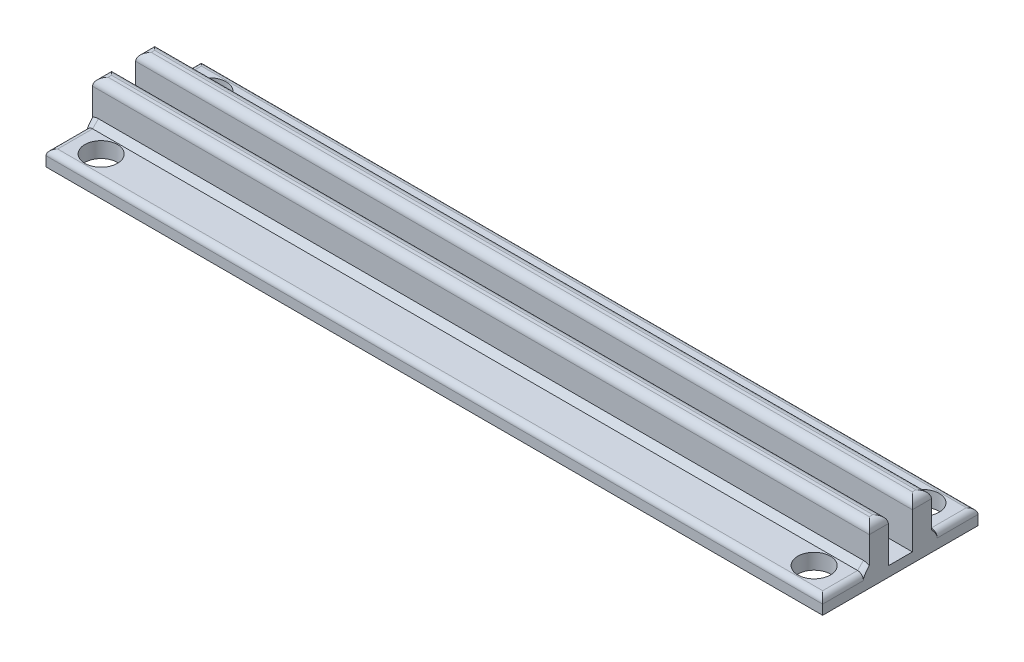
from build123d import *

# Parameters (mm, degrees)
SKETCH1_W           = 100
SKETCH1_H           = 8
BOSS_EXTRUDE1_DEPTH = 7
SKETCH3_W           = 100
SKETCH3_H           = 20
BOSS_EXTRUDE2_DEPTH = 2
SKETCH2_W           = 100
SKETCH2_H           = 3.1
CUT_EXTRUDE1_DEPTH  = 5.7
FILLET1_R           = 1
SKETCH4_R           = 2.1
CUT_EXTRUDE2_DEPTH  = 2
FILLET2_R           = 0.75
CHAMFER1_SIZE       = 0.75


with BuildPart() as part:
    # Sketch1 → Boss-Extrude1 (new body)
    with BuildSketch(Plane(origin=(0, 0, 0), x_dir=(1, 0, 0), z_dir=(0, 1, 0))):
        Rectangle(SKETCH1_W, SKETCH1_H)
    extrude(amount=BOSS_EXTRUDE1_DEPTH)

    # Sketch3 → Boss-Extrude2 (add)
    with BuildSketch(Plane(origin=(0, 0, 0), x_dir=(1, 0, 0), z_dir=(0, 1, 0))):
        Rectangle(SKETCH3_W, SKETCH3_H)
    extrude(amount=BOSS_EXTRUDE2_DEPTH)

    # Sketch2 → Cut-Extrude1 (cut)
    with BuildSketch(Plane(origin=(0, 7, 0), x_dir=(1, 0, 0), z_dir=(0, 1, 0))):
        Rectangle(SKETCH2_W, SKETCH2_H)
    extrude(amount=-CUT_EXTRUDE1_DEPTH, mode=Mode.SUBTRACT)

    # Fillet1
    fillet1_edges = [part.edges().sort_by_distance(p)[0] for p in [
        (-50, 7, -2.775),
        (0, 7, 4),
        (50, 7, -2.775),
        (-50, 7, 2.775),
        (0, 7, -1.55),
        (0, 7, 1.55),
        (50, 7, 2.775),
        (0, 7, -4),
    ]]
    fillet(fillet1_edges, radius=FILLET1_R)

    # Sketch4 → Cut-Extrude2 (cut)
    with BuildSketch(Plane(origin=(0, 2, 0), x_dir=(1, 0, 0), z_dir=(0, 1, 0))):
        with Locations(Location((-45.9, 7, 0), (0, 0, 270))):
            Circle(SKETCH4_R)
        with Locations(Location((-45.9, -7, 0), (0, 0, 270))):
            Circle(SKETCH4_R)
        with Locations(Location((45.9, 7, 0), (0, 0, 270))):
            Circle(SKETCH4_R)
        with Locations(Location((45.9, -7, 0), (0, 0, 270))):
            Circle(SKETCH4_R)
    extrude(amount=-CUT_EXTRUDE2_DEPTH, mode=Mode.SUBTRACT)

    # Fillet2
    fillet2_edges = [part.edges().sort_by_distance(p)[0] for p in [
        (-50, 2, -7),
        (50, 2, -7),
        (0, 2, -10),
        (50, 2, 7),
        (-50, 2, 7),
        (0, 2, 10),
    ]]
    fillet(fillet2_edges, radius=FILLET2_R)

    # Chamfer1
    # the kernel refuses this chamfer: 0.75 mm, written as the material it adds along each edge
    with BuildSketch(Plane(origin=(49.25, 2, -4), x_dir=(0, -0.02749587661058648, -0.9996219169112968), z_dir=(-1, 0, 0)), Plane(origin=(-49.25, 2, 4), x_dir=(0, -0.02749587661058648, 0.9996219169112968), z_dir=(1, 0, 0))) as chamfer1_piece_1:
        Polygon((CHAMFER1_SIZE * 0.999621916911, -CHAMFER1_SIZE * 0.0274958766106), (-CHAMFER1_SIZE * 0.0274958766106, -CHAMFER1_SIZE * 0.999621916911), (0, 0), align=None)
    extrude(amount=98.5)
    with BuildSketch(Plane(origin=(49.25, 1.25, -4), x_dir=(-0.8425066666450713, -0.5386859165215022, 0), z_dir=(-0.5386859165215022, 0.8425066666450713, 0))) as chamfer1_piece_2_section:
        Polygon((0.75, -CHAMFER1_SIZE), (0.75 + CHAMFER1_SIZE, 0), (0.75, 0), align=None)
    chamfer1_piece_2 = revolve(axis=Axis((49.25, 1.25, -4), (0, 0, 1)), revolution_arc=237.405771779, mode=Mode.PRIVATE)
    chamfer1_piece_2 = split(chamfer1_piece_2, bisect_by=Plane(origin=(50, 1.825736319, -4.33178547), z_dir=(-1, 0, 0)), keep=Keep.TOP, mode=Mode.PRIVATE)
    chamfer1_piece_2 = split(chamfer1_piece_2, bisect_by=Plane(origin=(49.825736319, 0, -4.33178547), z_dir=(0, 1, 0)), keep=Keep.TOP, mode=Mode.PRIVATE)
    add(chamfer1_piece_2)
    with BuildSketch(Plane(origin=(49.25, 1.25, 4), x_dir=(-0.8425066666450713, -0.5386859165215022, 0), z_dir=(-0.5386859165215022, 0.8425066666450713, 0))) as chamfer1_piece_3_section:
        Polygon((0.75 + CHAMFER1_SIZE, 0), (0.75, CHAMFER1_SIZE), (0.75, 0), align=None)
    chamfer1_piece_3 = revolve(axis=Axis((49.25, 1.25, 4), (0, 0, 1)), revolution_arc=237.405771779, mode=Mode.PRIVATE)
    chamfer1_piece_3 = split(chamfer1_piece_3, bisect_by=Plane(origin=(50, 1.825736319, 4.33178547), z_dir=(-1, 0, 0)), keep=Keep.TOP, mode=Mode.PRIVATE)
    chamfer1_piece_3 = split(chamfer1_piece_3, bisect_by=Plane(origin=(49.825736319, 0, 4.33178547), z_dir=(0, 1, 0)), keep=Keep.TOP, mode=Mode.PRIVATE)
    add(chamfer1_piece_3)
    with BuildSketch(Plane(origin=(-49.25, 1.25, 4), x_dir=(0, 1, 0), z_dir=(1, 0, 0))) as chamfer1_piece_4_section:
        Polygon((0.75, CHAMFER1_SIZE), (0.75 + CHAMFER1_SIZE, 0), (0.75, 0), align=None)
    chamfer1_piece_4 = revolve(axis=Axis((-49.25, 1.25, 4), (0, 0, 1)), revolution_arc=237.405771779, mode=Mode.PRIVATE)
    chamfer1_piece_4 = split(chamfer1_piece_4, bisect_by=Plane(origin=(-50, 1.825736319, 4.33178547), z_dir=(1, 0, 0)), keep=Keep.TOP, mode=Mode.PRIVATE)
    chamfer1_piece_4 = split(chamfer1_piece_4, bisect_by=Plane(origin=(-49.825736319, 0, 4.33178547), z_dir=(0, 1, 0)), keep=Keep.TOP, mode=Mode.PRIVATE)
    add(chamfer1_piece_4)
    with BuildSketch(Plane(origin=(-49.25, 1.25, -4), x_dir=(0, 1, 0), z_dir=(1, 0, 0))) as chamfer1_piece_5_section:
        Polygon((0.75, -CHAMFER1_SIZE), (0.75 + CHAMFER1_SIZE, 0), (0.75, 0), align=None)
    chamfer1_piece_5 = revolve(axis=Axis((-49.25, 1.25, -4), (0, 0, 1)), revolution_arc=237.405771779, mode=Mode.PRIVATE)
    chamfer1_piece_5 = split(chamfer1_piece_5, bisect_by=Plane(origin=(-50, 1.825736319, -4.33178547), z_dir=(1, 0, 0)), keep=Keep.TOP, mode=Mode.PRIVATE)
    chamfer1_piece_5 = split(chamfer1_piece_5, bisect_by=Plane(origin=(-49.825736319, 0, -4.33178547), z_dir=(0, 1, 0)), keep=Keep.TOP, mode=Mode.PRIVATE)
    add(chamfer1_piece_5)


solid = part.part
